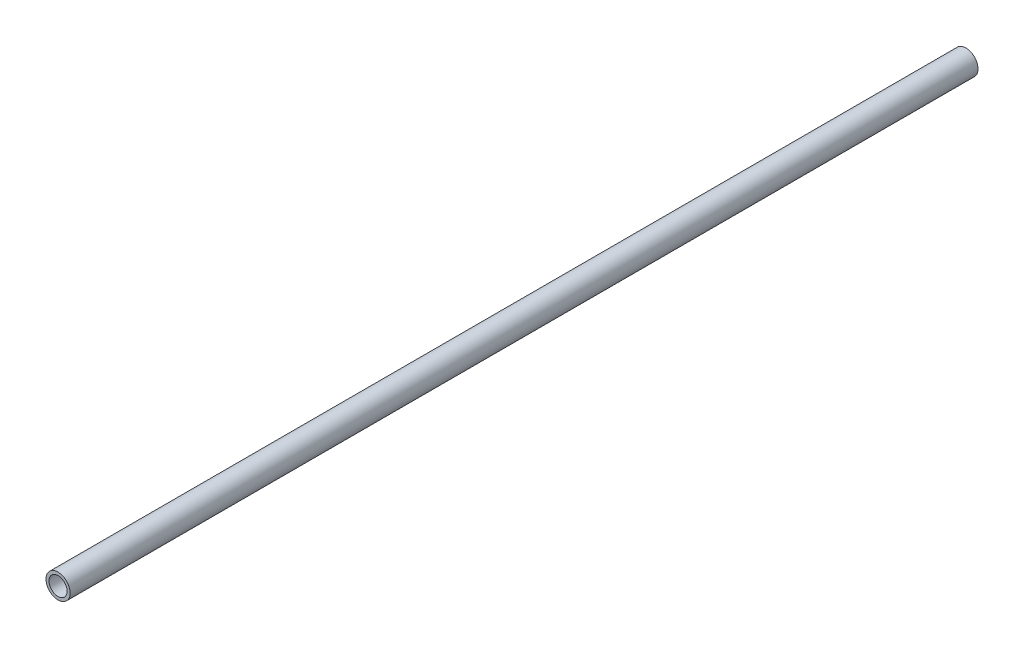
from build123d import *

# Parameters (mm, degrees)
SKETCH1_R           = 2
SKETCH1_R_2         = 1.5
BOSS_EXTRUDE1_DEPTH = 150.288000066


with BuildPart() as part:
    # Sketch1 → Boss-Extrude1 (new body)
    with BuildSketch(Plane.XY):
        Circle(SKETCH1_R)
        Circle(SKETCH1_R_2, mode=Mode.SUBTRACT)
    extrude(amount=BOSS_EXTRUDE1_DEPTH)


solid = part.part
